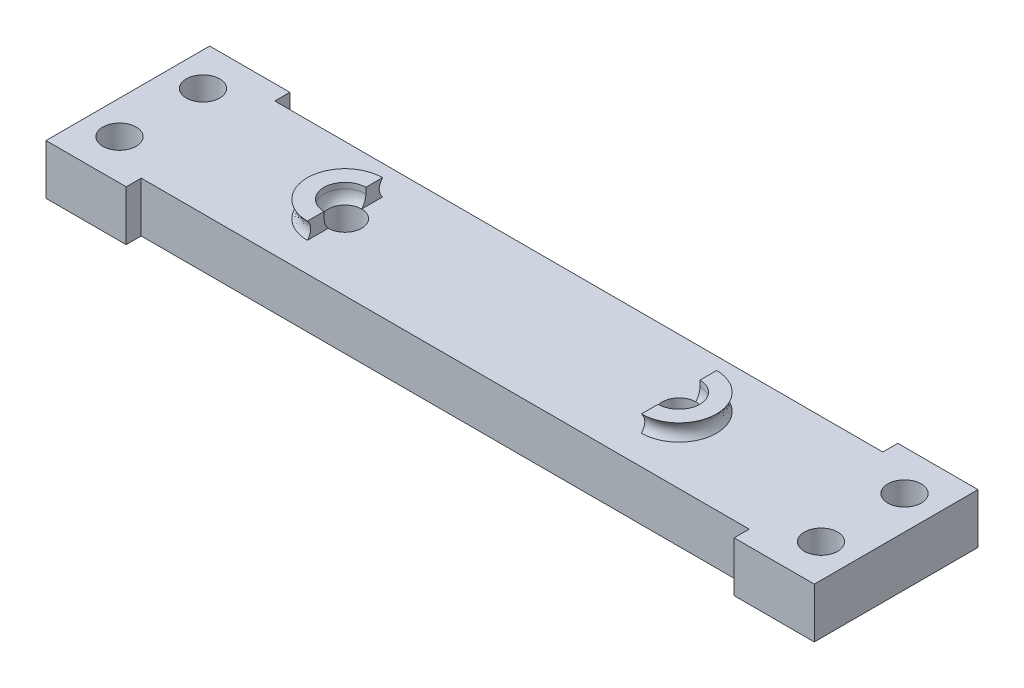
from build123d import *

# Parameters (mm, degrees)
SKETCH_1_R          = 1
EXTRUDE_2_DEPTH     = 4
EXTRUDE_3_DEPTH     = 1
CUT_EXTRUDE_2_DEPTH = 1
SKETCH_10_R         = 25.399360379
CUT_EXTRUDE_3_DEPTH = 3
SKETCH_11_R         = 29.436090692
CUT_EXTRUDE_4_DEPTH = 10
EXTRUDE_4_DEPTH     = 1
SKETCH_17_W         = 0.2
SKETCH_17_H         = 1
CUT_EXTRUDE_6_DEPTH = 4
SKETCH_18_W         = 4.8
SKETCH_18_H         = 0.1
CUT_EXTRUDE_7_DEPTH = 4
SKETCH_19_R         = 1
CUT_EXTRUDE_8_DEPTH = 4
FILLET_1_R          = 1
FILLET_2_R          = 1
EXTRUDE_START       = 2
SKETCH_21_R         = 1
EXTRUDE_5_DEPTH     = 2


with BuildPart() as part:
    # 草图1 → 凸台-拉伸2 (new body)
    with BuildSketch(Plane(origin=(0, 0, 0), x_dir=(1, 0, 0), z_dir=(0, 1, 0))):
        Polygon((-24.994291736, 0), (11.005708264, 0), (11.005708264, 1), (16.005708264, 1), (16.005708264, -9), (11.005708264, -9), (11.005708264, -8), (-24.994291736, -8), (-24.994291736, -9), (-29.994291736, -9), (-29.994291736, 1), (-24.994291736, 1), align=None)
        with Locations(Location((-27.994291736, -6.5, 0), (0, 0, 270))):
            Circle(SKETCH_1_R, mode=Mode.SUBTRACT)
        with Locations(Location((-27.994291736, -1.5, 0), (0, 0, 270))):
            Circle(SKETCH_1_R, mode=Mode.SUBTRACT)
        with Locations(Location((14.005708264, -1.5, 0), (0, 0, 270))):
            Circle(SKETCH_1_R, mode=Mode.SUBTRACT)
        with Locations(Location((14.005708264, -6.5, 0), (0, 0, 270))):
            Circle(SKETCH_1_R, mode=Mode.SUBTRACT)
    extrude(amount=EXTRUDE_2_DEPTH)

    # 草图2 → 凸台-拉伸3 (add)
    with BuildSketch(Plane(origin=(0, 4, 0), x_dir=(1, 0, 0), z_dir=(0, 1, 0))):
        with BuildLine():
            Line((-14.894291736, -1.75), (0.905708264, -1.75))
            ThreePointArc((0.905708264, -1.75), (3.155708264, -4), (0.905708264, -6.25))
            Line((0.905708264, -6.25), (-14.894291736, -6.25))
            ThreePointArc((-14.894291736, -6.25), (-17.144291736, -4), (-14.894291736, -1.75))
        make_face()
    extrude(amount=EXTRUDE_3_DEPTH)

    # 草图3 → 切除-拉伸2 (cut)
    with BuildSketch(Plane(origin=(0, 5, 0), x_dir=(1, 0, 0), z_dir=(0, 1, 0))):
        with BuildLine():
            Line((-14.894291736, -2.5), (-14.894291736, -1.75))
            Line((-14.894291736, -1.75), (0.905708264, -1.75))
            Line((0.905708264, -1.75), (0.905708264, -2.5))
            ThreePointArc((0.905708264, -2.5), (2.405708264, -4), (0.905708264, -5.5))
            Line((0.905708264, -5.5), (0.905708264, -6.25))
            Line((0.905708264, -6.25), (-14.894291736, -6.25))
            Line((-14.894291736, -6.25), (-14.894291736, -5.5))
            ThreePointArc((-14.894291736, -5.5), (-16.394291736, -4), (-14.894291736, -2.5))
        make_face()
    extrude(amount=-CUT_EXTRUDE_2_DEPTH, mode=Mode.SUBTRACT)

    # 切除-扫描2: sweep along a path in 草图5
    with BuildLine(Plane(origin=(0, 5, 0), x_dir=(1, 0, 0), z_dir=(0, 1, 0))) as sweep_2_path:
        CenterArc((-14.894291736, -4), 2.25, 0, 360)
    # 草图4 → 切除-扫描2 (sweep, cut)
    with BuildSketch(Plane(origin=(-14.894291736, 0, 0), x_dir=(0, 0, -1), z_dir=(1, 0, 0))):
        with BuildLine():
            Line((-6.25, 5), (-6.25, 4))
            add(Edge.make_bspline(
                [(-6.25, 5), (-5.95, 4.5), (-6.25, 4)],
                knots=[0, 0, 0, 1, 1, 1], degree=2))
        make_face()
    sweep(path=sweep_2_path.line, mode=Mode.SUBTRACT)

    # 切除-扫描3: sweep along a path in 草图9
    with BuildLine(Plane(origin=(0, 5, 0), x_dir=(1, 0, 0), z_dir=(0, 1, 0))) as sweep_3_path:
        CenterArc((0.905708264, -4), 2.25, 0, 360)
    # 草图8 → 切除-扫描3 (sweep, cut)
    with BuildSketch(Plane.ZY.offset(-0.905708264)):
        with BuildLine():
            Line((6.25, 4), (6.25, 5))
            add(Edge.make_bspline(
                [(6.25, 4), (5.95, 4.5), (6.25, 5)],
                knots=[0, 0, 0, 1, 1, 1], degree=2))
        make_face()
    sweep(path=sweep_3_path.line, mode=Mode.SUBTRACT)

    # 草图10 → 切除-拉伸3 (cut)
    with BuildSketch(Plane.XZ):
        with Locations((-6.994291736, 4.240455063)):
            Circle(SKETCH_10_R)
    extrude(amount=-CUT_EXTRUDE_3_DEPTH, mode=Mode.SUBTRACT)

    # 草图11 → 切除-拉伸4 (cut)
    with BuildSketch(Plane(origin=(0, 4, 0), x_dir=(1, 0, 0), z_dir=(0, 1, 0))):
        with Locations((-7.872659643, -3.561647991)):
            Circle(SKETCH_11_R)
    extrude(amount=CUT_EXTRUDE_4_DEPTH, mode=Mode.SUBTRACT)

    # 草图12 → 凸台-拉伸4 (add)
    with BuildSketch(Plane(origin=(0, 4, 0), x_dir=(1, 0, 0), z_dir=(0, 1, 0))):
        with BuildLine():
            Line((-16.994291736, -1.75), (-16.994291736, -2.75))
            ThreePointArc((-16.994291736, -2.75), (-18.244291736, -4), (-16.994291736, -5.25))
            Line((-16.994291736, -5.25), (-16.994291736, -6.25))
            ThreePointArc((-16.994291736, -6.25), (-19.244291736, -4), (-16.994291736, -1.75))
        make_face()
        with BuildLine():
            Line((3.005708264, -1.75), (3.005708264, -2.75))
            ThreePointArc((3.005708264, -2.75), (4.255708264, -4), (3.005708264, -5.25))
            Line((3.005708264, -5.25), (3.005708264, -6.25))
            ThreePointArc((3.005708264, -6.25), (5.255708264, -4), (3.005708264, -1.75))
        make_face()
    extrude(amount=EXTRUDE_4_DEPTH)

    # 切除-扫描4: sweep along a path in 草图14
    with BuildLine(Plane(origin=(0, 5, 0), x_dir=(1, 0, 0), z_dir=(0, 1, 0))) as sweep_4_path:
        CenterArc((-16.994291736, -4), 2.25, 0, 360)
    # 草图13 → 切除-扫描4 (sweep, cut)
    with BuildSketch(Plane(origin=(-16.994291736, 0, 0), x_dir=(0, 0, -1), z_dir=(1, 0, 0))):
        with BuildLine():
            Line((-1.75, 5), (-1.75, 4))
            add(Edge.make_bspline(
                [(-1.75, 5), (-2.15, 4.5), (-1.75, 4)],
                knots=[0, 0, 0, 1, 1, 1], degree=2))
        make_face()
    sweep(path=sweep_4_path.line, mode=Mode.SUBTRACT)

    # 切除-扫描5: sweep along a path in 草图16
    with BuildLine(Plane(origin=(0, 5, 0), x_dir=(1, 0, 0), z_dir=(0, 1, 0))) as sweep_5_path:
        CenterArc((3.005708264, -4), 2.25, 0, 360)
    # 草图15 → 切除-扫描5 (sweep, cut)
    with BuildSketch(Plane.ZY.offset(-3.005708264)):
        with BuildLine():
            Line((1.75, 5), (1.75, 4))
            add(Edge.make_bspline(
                [(1.75, 5), (2.15, 4.5), (1.75, 4)],
                knots=[0, 0, 0, 1, 1, 1], degree=2))
        make_face()
    sweep(path=sweep_5_path.line, mode=Mode.SUBTRACT)

    # 草图17 → 切除-拉伸6 (cut)
    with BuildSketch(Plane.XZ.offset(-3)):
        with Locations((-25.094291736, 8.5)):
            Rectangle(SKETCH_17_W, SKETCH_17_H)
        with Locations((-25.094291736, -0.5)):
            Rectangle(SKETCH_17_W, SKETCH_17_H)
        with Locations((11.105708264, 8.5)):
            Rectangle(SKETCH_17_W, SKETCH_17_H)
        with Locations((11.105708264, -0.5)):
            Rectangle(SKETCH_17_W, SKETCH_17_H)
    extrude(amount=-CUT_EXTRUDE_6_DEPTH, mode=Mode.SUBTRACT)

    # 草图18 → 切除-拉伸7 (cut)
    with BuildSketch(Plane.XZ.offset(-3)):
        with Locations((13.605708264, 8.95)):
            Rectangle(SKETCH_18_W, SKETCH_18_H)
        with Locations((13.605708264, -0.95)):
            Rectangle(SKETCH_18_W, SKETCH_18_H)
        with Locations((-27.594291736, 8.95)):
            Rectangle(SKETCH_18_W, SKETCH_18_H)
        with Locations((-27.594291736, -0.95)):
            Rectangle(SKETCH_18_W, SKETCH_18_H)
    extrude(amount=-CUT_EXTRUDE_7_DEPTH, mode=Mode.SUBTRACT)

    # 草图19 → 切除-拉伸8 (cut)
    with BuildSketch(Plane(origin=(0, 4, 0), x_dir=(1, 0, 0), z_dir=(0, 1, 0))):
        with Locations(Location((3.005708264, -4, 0), (0, 0, 270))):
            Circle(SKETCH_19_R)
        with Locations(Location((-16.994291736, -4, 0), (0, 0, 270))):
            Circle(SKETCH_19_R)
    extrude(amount=-CUT_EXTRUDE_8_DEPTH, mode=Mode.SUBTRACT)

    # 圆角1
    # the kernel refuses this fillet: 1 mm, written as the material it adds along each edge
    with BuildSketch(Plane(origin=(-16.994291736, 4, 4), x_dir=(0, 0, -1), z_dir=(1, 0, 0))) as fillet_1_piece_1:
        with BuildLine():
            CenterArc((0.25, 0.661437828), FILLET_1_R, 318.590377891, 41.409622109)
            Line((1.25, 0.661437828), (1.27, 0.661437828))
            Line((1.27, 0.661437828), (1.27, 0))
            Line((1.27, 0), (1.25, -0.02))
            ThreePointArc((1.25, -0.02), (1.125, -0.02), (1.015, -0.013228757))
            Line((1.015, -0.013228757), (1, 0))
        make_face()
    revolve(axis=Axis((-16.994291736, 4, 4), (0, 1, 0)), revolution_arc=180)

    # 圆角2
    # the kernel refuses this fillet: 1 mm, written as the material it adds along each edge
    with BuildSketch(Plane(origin=(3.005708264, 4, 4), x_dir=(0, 0, -1), z_dir=(-1, 0, 0))) as fillet_2_piece_1:
        with BuildLine():
            CenterArc((0.25, -0.661437828), FILLET_2_R, 0, 41.409622109)
            Line((1.25, -0.661437828), (1.27, -0.661437828))
            Line((1.27, -0.661437828), (1.27, 0))
            Line((1.27, 0), (1.25, 0.02))
            ThreePointArc((1.25, 0.02), (1.125, 0.02), (1.015, 0.013228757))
            Line((1.015, 0.013228757), (1, 0))
        make_face()
    revolve(axis=Axis((3.005708264, 4, 4), (0, -1, 0)), revolution_arc=180)

    # 草图21 → 凸台-拉伸5 (add)
    with BuildSketch(Plane.XZ.offset(-3).offset(EXTRUDE_START)):
        Polygon((-29.994291736, 8.9), (-25.194291736, 8.9), (-25.194291736, 8), (11.205708264, 8), (11.205708264, 8.9), (16.005708264, 8.9), (16.005708264, -0.9), (11.205708264, -0.9), (11.205708264, 0), (-25.194291736, 0), (-25.194291736, -0.9), (-29.994291736, -0.9), align=None)
        with Locations(Location((-27.994291736, 6.5, 0), (0, 0, 270))):
            Circle(SKETCH_21_R, mode=Mode.SUBTRACT)
        with Locations(Location((-27.994291736, 1.5, 0), (0, 0, 270))):
            Circle(SKETCH_21_R, mode=Mode.SUBTRACT)
        with Locations(Location((-16.994291736, 4, 0), (0, 0, 270))):
            Circle(SKETCH_21_R, mode=Mode.SUBTRACT)
        with Locations(Location((3.005708264, 4, 0), (0, 0, 270))):
            Circle(SKETCH_21_R, mode=Mode.SUBTRACT)
        with Locations(Location((14.005708264, 6.5, 0), (0, 0, 270))):
            Circle(SKETCH_21_R, mode=Mode.SUBTRACT)
        with Locations(Location((14.005708264, 1.5, 0), (0, 0, 270))):
            Circle(SKETCH_21_R, mode=Mode.SUBTRACT)
    extrude(amount=-EXTRUDE_5_DEPTH)


solid = part.part
